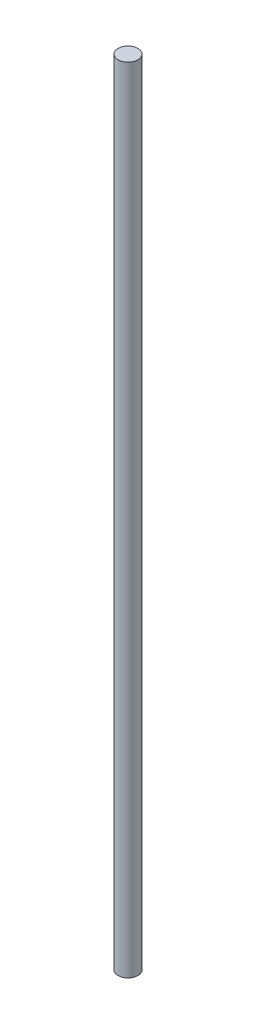
from build123d import *

# Parameters (mm, degrees)
SKETCH1_R           = 2.5
BOSS_EXTRUDE1_DEPTH = 200


with BuildPart() as part:
    # Sketch1 → Boss-Extrude1 (new body)
    with BuildSketch(Plane(origin=(0, 0, 0), x_dir=(1, 0, 0), z_dir=(0, 1, 0))):
        Circle(SKETCH1_R)
    extrude(amount=BOSS_EXTRUDE1_DEPTH)


solid = part.part
